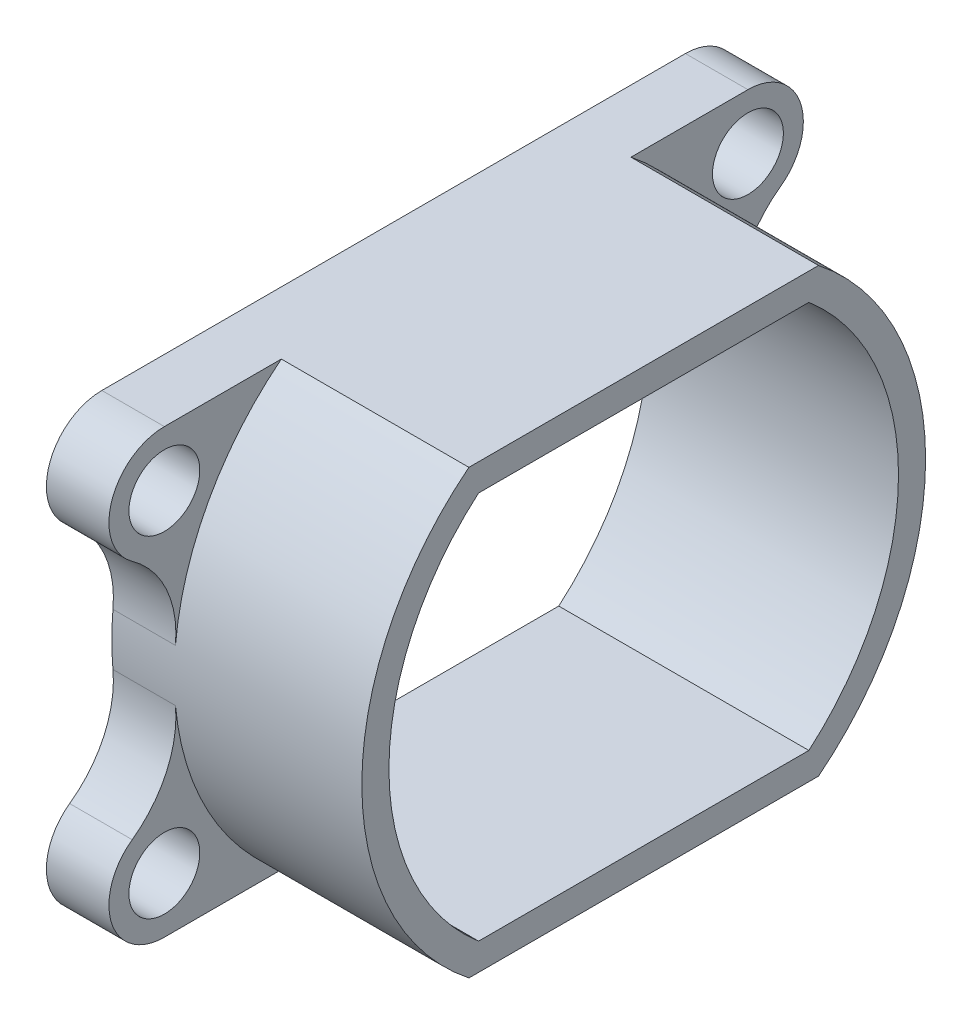
from build123d import *

# Parameters (mm, degrees)
MOTOR_HOLDER_DEPTH  = 12
SKETCH2_R           = 1.7
BOSS_EXTRUDE1_DEPTH = 3
FILLET1_R           = 5


with BuildPart() as part:
    # Sketch1 → Motor Holder (new body)
    with BuildSketch(Plane(origin=(0, 0, 0), x_dir=(0, 0, -1), z_dir=(1, 0, 0))):
        with BuildLine():
            Line((-8.387700817, 10.61), (8.387700817, 10.61))
            ThreePointArc((8.387700817, 10.61), (13.525, 0), (8.387700817, -10.61))
            Line((8.387700817, -10.61), (-8.387700817, -10.61))
            ThreePointArc((-8.387700817, -10.61), (-13.525, 0), (-8.387700817, 10.61))
        make_face()
        with BuildLine():
            Line((-7.923037612, 9.31), (7.923037612, 9.31))
            ThreePointArc((7.923037612, 9.31), (12.225, 0), (7.923037612, -9.31))
            Line((7.923037612, -9.31), (-7.923037612, -9.31))
            ThreePointArc((-7.923037612, -9.31), (-12.225, 0), (-7.923037612, 9.31))
        make_face(mode=Mode.SUBTRACT)
    extrude(amount=MOTOR_HOLDER_DEPTH)

    # Sketch2 → Boss-Extrude1 (add)
    # profile 1 of 4: a face of its own
    with BuildSketch(Plane.ZY):
        with BuildLine():
            Line((-14.913279506, 5.451696467), (-12.702840333, 4.643648617))
            ThreePointArc((-12.702840333, 4.643648617), (-10.959108938, 7.926131231), (-8.387700817, 10.61))
            Line((-8.387700817, 10.61), (-14, 10.61))
            ThreePointArc((-14, 10.61), (-16.619263961, 8.413741632), (-14.913279506, 5.451696467))
        make_face()
        with Locations((-14, 7.95)):
            Circle(SKETCH2_R, mode=Mode.SUBTRACT)
    # profile 2 of 4: a face of its own
    with BuildSketch(Plane.ZY):
        with BuildLine():
            Line((-14, -10.61), (-8.387700817, -10.61))
            ThreePointArc((-8.387700817, -10.61), (-10.959108938, -7.926131231), (-12.702840333, -4.643648617))
            Line((-12.702840333, -4.643648617), (-14.913279506, -5.451696467))
            ThreePointArc((-14.913279506, -5.451696467), (-16.619263961, -8.413741632), (-14, -10.61))
        make_face()
        with Locations((-14, -7.95)):
            Circle(SKETCH2_R, mode=Mode.SUBTRACT)
    # profile 3 of 4: a face of its own
    with BuildSketch(Plane.ZY):
        with BuildLine():
            Line((14.913279506, -5.451696467), (12.702840333, -4.643648617))
            ThreePointArc((12.702840333, -4.643648617), (10.959108938, -7.926131231), (8.387700817, -10.61))
            Line((8.387700817, -10.61), (14, -10.61))
            ThreePointArc((14, -10.61), (16.619263961, -8.413741632), (14.913279506, -5.451696467))
        make_face()
        with Locations((14, -7.95)):
            Circle(SKETCH2_R, mode=Mode.SUBTRACT)
    # profile 4 of 4: a face of its own
    with BuildSketch(Plane.ZY):
        with BuildLine():
            Line((14, 10.61), (8.387700817, 10.61))
            ThreePointArc((8.387700817, 10.61), (10.959108938, 7.926131231), (12.702840333, 4.643648617))
            Line((12.702840333, 4.643648617), (14.913279506, 5.451696467))
            ThreePointArc((14.913279506, 5.451696467), (16.619263961, 8.413741632), (14, 10.61))
        make_face()
        with Locations((14, 7.95)):
            Circle(SKETCH2_R, mode=Mode.SUBTRACT)
    extrude(amount=-BOSS_EXTRUDE1_DEPTH)

    # Fillet1
    # the kernel refuses this fillet: 5 mm, written as the material it adds along each edge
    with BuildSketch(Plane(origin=(0, -4.643648617, -12.702840333), x_dir=(0, -0.37246154251752206, -0.9280476277354887), z_dir=(1, 0, 0)), Plane(origin=(0, 4.643648617, 12.702840333), x_dir=(0, 0.3724615425175231, 0.9280476277354882), z_dir=(1, 0, 0))) as fillet1_piece_1:
        with BuildLine():
            CenterArc((4.237774009, 4.85960426), FILLET1_R, 196.564565372, 59.825655305)
            Line((-0.554721368, 3.434126074), (-1.033970906, 3.291578255))
            ThreePointArc((-1.033970906, 3.291578255), (-0.660094703, 1.655239232), (-0.499756797, -0.015593065))
            Line((-0.499756797, -0.015593065), (0.015593065, -0.499756797))
            ThreePointArc((0.015593065, -0.499756797), (2.367952645, -0.426360103), (2.94357998, -0.485960426))
            Line((2.94357998, -0.485960426), (3.061233982, 0))
        make_face()
    extrude(amount=3)
    with BuildSketch(Plane(origin=(0, 4.643648617, -12.702840333), x_dir=(0, 0.3724615425175213, -0.9280476277354889), z_dir=(1, 0, 0)), Plane(origin=(0, -4.643648617, 12.702840333), x_dir=(0, -0.37246154251752195, 0.9280476277354888), z_dir=(1, 0, 0))) as fillet1_piece_2:
        with BuildLine():
            CenterArc((4.237774009, -4.85960426), FILLET1_R, 103.609779323, 59.825655305)
            Line((-0.554721368, -3.434126074), (-1.033970906, -3.291578255))
            ThreePointArc((-1.033970906, -3.291578255), (-0.660094703, -1.655239232), (-0.499756797, 0.015593065))
            Line((-0.499756797, 0.015593065), (0.015593065, 0.499756797))
            ThreePointArc((0.015593065, 0.499756797), (2.367952645, 0.426360103), (2.94357998, 0.485960426))
            Line((2.94357998, 0.485960426), (3.061233982, 0))
        make_face()
    extrude(amount=3)


solid = part.part
